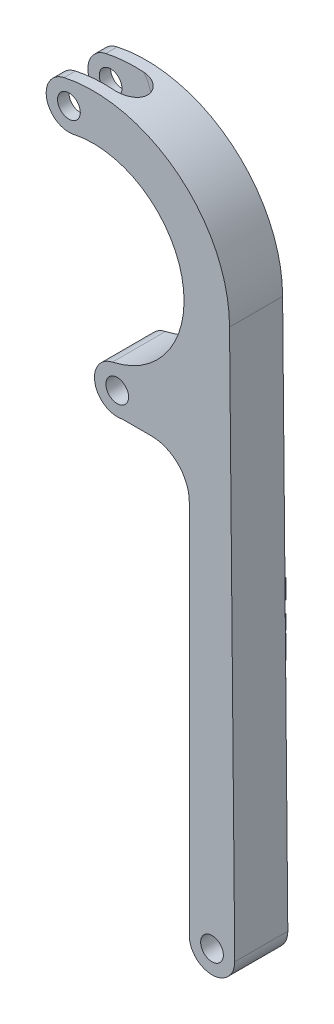
from build123d import *

# Parameters (mm, degrees)
CROQUIS1_R                  = 6
CROQUIS1_R_2                = 3
SALIENTE_EXTRUIR1_DEPTH     = 14
CORTAR_EXTRUIR1_START       = -3
CROQUIS3_R                  = 15
CORTAR_EXTRUIR1_DEPTH       = 8
REDONDEO1_R                 = 4
SALIENTE_EXTRUIR2_OUTLINE_W = 2.164556962
SALIENTE_EXTRUIR2_OUTLINE_H = 3.727848101
SALIENTE_EXTRUIR2_DEPTH     = 1


# Read off the part's stored shape, not the designer's step: Saliente-Extruir2
with BuildPart() as part:
    # Croquis1 → Saliente-Extruir1 (new body)
    # profile 1 of 5: a face of its own
    with BuildSketch(Plane.XY):
        with BuildLine():
            ThreePointArc((-23.725422134, 109.136941816), (-3.343361872, 121.724461131), (4.62711067, 144.315290918))
            ThreePointArc((4.62711067, 144.315290918), (-8.782059543, 172.344818376), (-39.020356526, 179.493640019))
            ThreePointArc((-39.020356526, 179.493640019), (-33.980640362, 178.302169745), (-31.74577866, 173.630581835))
            ThreePointArc((-31.74577866, 173.630581835), (-33.07419075, 169.865443538), (-36.471200794, 167.767523652))
            ThreePointArc((-36.471200794, 167.767523652), (-7.920656596, 149.413602382), (-26.274577866, 120.863058184))
            ThreePointArc((-26.274577866, 120.863058184), (-21.234861702, 119.67158791), (-19, 115))
            ThreePointArc((-19, 115), (-20.32841209, 111.234861702), (-23.725422134, 109.136941816))
        make_face()
    # profile 2 of 5: a face of its own
    with BuildSketch(Plane.XY):
        with Locations((-37.74577866, 173.630581835)):
            Circle(CROQUIS1_R)
        with Locations((-37.74577866, 173.630581835)):
            Circle(CROQUIS1_R_2, mode=Mode.SUBTRACT)
    # profile 3 of 5: a face of its own
    with BuildSketch(Plane.XY):
        with Locations((-25, 115)):
            Circle(CROQUIS1_R)
        with Locations((-25, 115)):
            Circle(CROQUIS1_R_2, mode=Mode.SUBTRACT)
    # profile 4 of 5: a face of its own
    with BuildSketch(Plane.XY):
        with BuildLine():
            Line((5.998914104, 0.114147164), (4.62711067, 144.315290918))
            ThreePointArc((4.62711067, 144.315290918), (-3.343361872, 121.724461131), (-23.725422134, 109.136941816))
            Line((-23.725422134, 109.136941816), (-16, 109.136941816))
            ThreePointArc((-16, 109.136941816), (-8.928932188, 106.208009628), (-6, 99.136941816))
            Line((-6, 99.136941816), (-6, 0))
            ThreePointArc((-6, 0), (-0.057076164, 5.99972852), (5.998914104, 0.114147164))
        make_face()
    # profile 5 of 5: a face of its own
    with BuildSketch(Plane.XY):
        with BuildLine():
            Line((6, 0), (5.998914104, 0.114147164))
            ThreePointArc((5.998914104, 0.114147164), (-0.057076164, 5.99972852), (-6, 0))
            ThreePointArc((-6, 0), (0, -6), (6, 0))
        make_face()
        Circle(CROQUIS1_R_2, mode=Mode.SUBTRACT)
    extrude(amount=SALIENTE_EXTRUIR1_DEPTH)

    # Croquis3 → Cortar-Extruir1 (cut)
    with BuildSketch(Plane.XY.offset(14).offset(CORTAR_EXTRUIR1_START)):
        with Locations((-37.74577866, 173.630581835)):
            Circle(CROQUIS3_R)
    extrude(amount=-CORTAR_EXTRUIR1_DEPTH, mode=Mode.SUBTRACT)

    # Redondeo1
    redondeo1_edges = [part.edges().sort_by_distance(p)[0] for p in [
        (-22.748314626, 173.3547693, 11),
        (-22.748314626, 173.3547693, 3),
    ]]
    fillet(redondeo1_edges, radius=REDONDEO1_R - 0.0001)  # a hair under: the kernel refuses the full size

    # Saliente-Extruir2 outline → Saliente-Extruir2 (add)
    # profile 1 of 5: a face of its own
    with BuildSketch(Plane(origin=(0, 0, 0), x_dir=(-1, 0, 0), z_dir=(0, 0, -1))):
        with BuildLine():
            add(Edge.make_bspline(
                [(1.227056962, 45.382004268), (1.173159704, 45.369650546), (1.070700251, 45.346165946), (0.925715434, 45.310156466), (0.799895763, 45.268441386), (0.691113524, 45.226076926), (0.60177617, 45.179003969), (0.52787352, 45.133055417), (0.473706833, 45.08166438), (0.425672622, 45.010214269), (0.391970564, 44.912875635), (0.353697368, 44.795216564), (0.332649693, 44.667344204), (0.32075523, 44.538593351), (0.314885121, 44.420040011), (0.315663804, 44.324068642), (0.309504425, 44.256562467), (0.309959197, 44.220814461), (0.310126582, 44.207656957)],
                knots=[0, 0, 0, 0, 0.096369473, 0.183199736, 0.260168196, 0.327254605, 0.3863241, 0.435970048, 0.47842448, 0.515356776, 0.584876185, 0.656696535, 0.730987281, 0.809942154, 0.882052186, 0.9377268, 0.977079565, 1, 1, 1, 1], degree=3))
            add(Edge.make_bspline(
                [(5.120253165, 48.145948097), (5.118708681, 48.058168777), (5.115687299, 47.886451362), (5.084472475, 47.635717516), (5.035984154, 47.398073021), (4.969199014, 47.173408624), (4.87956714, 46.962747327), (4.770972882, 46.765431517), (4.642013421, 46.581846155), (4.495347874, 46.413097551), (4.333230987, 46.258885691), (4.158945594, 46.120037812), (3.972737567, 45.997542333), (3.777243482, 45.887225293), (3.568107684, 45.795297104), (3.347351057, 45.721614399), (3.117109939, 45.657300404), (2.800609835, 45.602716602), (2.416872586, 45.55068649), (1.98460854, 45.484255597), (1.592315981, 45.430630737), (1.344187055, 45.397597648), (1.227056962, 45.382004268)],
                knots=[0, 0, 0, 0, 0.048830607, 0.095524386, 0.140369232, 0.183705339, 0.225721861, 0.26753402, 0.3088257, 0.350338942, 0.391758422, 0.433185235, 0.474175684, 0.515683073, 0.557976288, 0.601076244, 0.645129756, 0.690866583, 0.77964743, 0.860689261, 0.934237897, 1, 1, 1, 1], degree=3))
            add(Edge.make_bspline(
                [(2.234177215, 50.941834173), (2.34816094, 50.940388368), (2.561806769, 50.937678419), (2.86115806, 50.927487878), (3.116063253, 50.899803747), (3.337305252, 50.868609769), (3.539354567, 50.810513999), (3.739152001, 50.72554723), (3.943053922, 50.60588426), (4.152315372, 50.459384519), (4.358323192, 50.279003973), (4.542098846, 50.055376232), (4.708876089, 49.797099796), (4.852352516, 49.50474813), (4.972298269, 49.18803868), (5.059216596, 48.853089587), (5.11073964, 48.503935603), (5.117052847, 48.266373887), (5.120253165, 48.145948097)],
                knots=[0, 0, 0, 0, 0.074185321, 0.139049541, 0.194770103, 0.24100215, 0.284220415, 0.331153137, 0.381906579, 0.437765584, 0.497232502, 0.559433925, 0.625453012, 0.696901012, 0.770932802, 0.845466592, 0.92166327, 1, 1, 1, 1], degree=3))
            Line((2.234177215, 50.941834173), (2.234177215, 50.34056835))
            add(Edge.make_bspline(
                [(3.556962025, 49.906529584), (3.552597669, 49.945128712), (3.543920552, 50.021870649), (3.470889776, 50.124395241), (3.35331539, 50.197602254), (3.19761032, 50.251694462), (3.005845779, 50.290216197), (2.779194992, 50.319635603), (2.518206544, 50.338335605), (2.332543151, 50.339795099), (2.234177215, 50.34056835)],
                knots=[0, 0, 0, 0, 0.076379624, 0.151856288, 0.240834607, 0.348656789, 0.478908566, 0.630026959, 0.803985354, 1, 1, 1, 1], degree=3))
            add(Edge.make_bspline(
                [(0.29876583, 46.818984467), (0.305010012, 46.845440727), (0.34950794, 47.0325525), (0.416573676, 47.297639054), (0.514956713, 47.607976841), (0.606020567, 47.82981103), (0.713594595, 48.041645814), (0.834995702, 48.247000987), (0.981155861, 48.440962338), (1.155190055, 48.621934121), (1.358292774, 48.789640667), (1.586797318, 48.943125956), (1.832800975, 49.085385316), (2.092469224, 49.209012446), (2.358341477, 49.324570845), (2.627429543, 49.416386083), (2.876837949, 49.497545349), (3.086119187, 49.574677601), (3.248583592, 49.641062616), (3.367685907, 49.699915448), (3.452690074, 49.75430272), (3.507993909, 49.806695632), (3.548968439, 49.854739459), (3.55446263, 49.890336104), (3.556962025, 49.906529584)],
                knots=[0.081915594, 0.081915594, 0.081915594, 0.081915594, 0.097538274, 0.192448475, 0.239008343, 0.284532479, 0.330092183, 0.375468061, 0.421473558, 0.469338538, 0.51943898, 0.572556267, 0.627386583, 0.682608998, 0.737770368, 0.793900495, 0.845923327, 0.888519618, 0.922080751, 0.946712341, 0.964883242, 0.979655531, 0.990744977, 1, 1, 1, 1], degree=3))
            add(Edge.make_bspline(
                [(-2.108089399, 49.378543033), (-2.034709827, 49.376836932), (-1.886714385, 49.373395984), (-1.664114164, 49.341794784), (-1.439752252, 49.290890588), (-1.215845481, 49.219747719), (-0.996178509, 49.129993255), (-0.789679205, 49.011759465), (-0.596920915, 48.869789401), (-0.418152323, 48.704340335), (-0.256203892, 48.514829842), (-0.109785093, 48.303759864), (0.012730883, 48.066389421), (0.122186464, 47.806045473), (0.210116591, 47.512482809), (0.266851139, 47.179312711), (0.291312525, 46.9435085), (0.29876583, 46.818984467)],
                knots=[0, 0, 0, 0, 0.050680846, 0.102215562, 0.155024707, 0.209499325, 0.264395211, 0.318664872, 0.3734566, 0.429498824, 0.486579154, 0.545399895, 0.60657439, 0.670791493, 0.740348486, 0.817765563, 0.903985057, 0.903985057, 0.903985057, 0.903985057], degree=3))
            add(Edge.make_bspline(
                [(-4.511273734, 45.006213128), (-4.50955198, 45.197874208), (-4.506265139, 45.563756483), (-4.489306502, 46.087122363), (-4.454387377, 46.558202681), (-4.412866419, 46.981683256), (-4.346223538, 47.362569926), (-4.250785232, 47.706510805), (-4.128074335, 48.017158373), (-3.973539436, 48.291875577), (-3.797983089, 48.53567549), (-3.604438035, 48.749855269), (-3.395184801, 48.93706426), (-3.169745427, 49.095919475), (-2.926736648, 49.222450495), (-2.667805384, 49.314402844), (-2.392697869, 49.367209362), (-2.204138201, 49.37471818), (-2.108089399, 49.378543033)],
                knots=[0, 0, 0, 0, 0.102271433, 0.195236845, 0.279334408, 0.354289543, 0.422202057, 0.485367847, 0.544447062, 0.599953094, 0.65309905, 0.70444401, 0.753678076, 0.802630048, 0.851208711, 0.89940654, 0.948759555, 1, 1, 1, 1], degree=3))
            Line((-4.511273734, 45.006213128), (-4.5, 39.202118983))
            Line((-4.5, 39.202118983), (-4.026503165, 39.202118983))
            add(Edge.make_bspline(
                [(-3.29934731, 40.694009806), (-3.354570666, 40.687429536), (-3.455793411, 40.675368101), (-3.594785691, 40.645539064), (-3.704452405, 40.598708327), (-3.791925773, 40.541061855), (-3.853058942, 40.464427682), (-3.904170593, 40.37581224), (-3.93760305, 40.267890795), (-3.967479803, 40.109542612), (-3.988013174, 39.915338289), (-4.001189625, 39.688885825), (-4.008928354, 39.454357996), (-4.020265015, 39.291650799), (-4.026503165, 39.202118983)],
                knots=[0, 0, 0, 0, 0.087697202, 0.160746326, 0.223110375, 0.274881745, 0.323935795, 0.376110499, 0.435437977, 0.500891392, 0.630107775, 0.742885759, 0.858519443, 1, 1, 1, 1], degree=3))
            Line((-3.29934731, 40.694009806), (-2.724386867, 40.720315185))
            Line((-2.724386867, 40.720315185), (3.241297468, 40.720315185))
            Line((3.241297468, 40.720315185), (3.814378956, 40.694009806))
            add(Edge.make_bspline(
                [(4.518987342, 39.688768508), (4.507538536, 39.775185648), (4.485385726, 39.942398065), (4.460700286, 40.147081496), (4.43642724, 40.297533553), (4.404232927, 40.394410814), (4.359020701, 40.475991406), (4.300050123, 40.546569833), (4.218228783, 40.603024253), (4.109125318, 40.64534776), (3.971521721, 40.67538151), (3.869634415, 40.687459615), (3.814378956, 40.694009806)],
                knots=[0, 0, 0, 0, 0.185069921, 0.358100129, 0.437911598, 0.508140796, 0.573626925, 0.634928682, 0.701711692, 0.782218098, 0.881892656, 1, 1, 1, 1], degree=3))
            Line((4.518987342, 39.688768508), (4.518987342, 39.177692559))
            Line((4.518987342, 39.177692559), (5, 39.177692559))
            Line((5, 39.177692559), (5, 45.772827052))
            Line((5, 45.772827052), (4.537776899, 45.772827052))
            Line((4.537776899, 45.772827052), (4.473892405, 44.880323097))
            add(Edge.make_bspline(
                [(3.761768196, 44.232083381), (3.82277716, 44.239373602), (3.935273973, 44.252816326), (4.086836127, 44.292155155), (4.207665228, 44.34065284), (4.300604554, 44.405828464), (4.364882829, 44.494051534), (4.415520272, 44.600999153), (4.452037737, 44.732676684), (4.466260526, 44.828763422), (4.473892405, 44.880323097)],
                knots=[0, 0, 0, 0, 0.17001206, 0.313491885, 0.432393444, 0.529196786, 0.623224729, 0.731071164, 0.855694099, 1, 1, 1, 1], degree=3))
            Line((3.761768196, 44.232083381), (3.17929193, 44.205778002))
            Line((3.17929193, 44.205778002), (0.310126582, 44.207656957))
        make_face()
        with BuildLine():
            add(Edge.make_bspline(
                [(-0.170886076, 44.410584173), (-0.17099814, 44.466967138), (-0.171211178, 44.574153473), (-0.179477643, 44.727002716), (-0.189595814, 44.863126554), (-0.201198224, 44.948006441), (-0.206586234, 44.987423571)],
                knots=[0, 0, 0, 0, 0.292362208, 0.555792576, 0.79371577, 1, 1, 1, 1], degree=3))
            Line((-0.170886076, 44.410584173), (-0.170886076, 44.207656957))
            Line((-0.170886076, 44.207656957), (-4.018987342, 44.207656957))
            add(Edge.make_bspline(
                [(-2.119363133, 45.891201261), (-2.215359457, 45.888296319), (-2.407155602, 45.882492382), (-2.693322531, 45.835714803), (-2.975802212, 45.75817693), (-3.204872419, 45.669513036), (-3.378875534, 45.588013513), (-3.496333748, 45.524525772), (-3.598608672, 45.457069042), (-3.685455356, 45.385119577), (-3.759142923, 45.311633421), (-3.821154693, 45.237052234), (-3.865048598, 45.156189197), (-3.919950274, 44.996788942), (-3.964052212, 44.763099694), (-3.995379634, 44.518766799), (-3.996931059, 44.350914042), (-4.008496697, 44.272809251), (-4.003579853, 44.221729518), (-4.016995393, 44.20947632), (-4.018987342, 44.207656957)],
                knots=[0, 0, 0, 0, 0.098172887, 0.196144815, 0.295787264, 0.397412639, 0.447001532, 0.492311345, 0.533897757, 0.572130218, 0.607471872, 0.640295697, 0.670979507, 0.700979941, 0.812462339, 0.913015421, 0.954070211, 0.981690621, 0.997281411, 1, 1, 1, 1], degree=3))
            add(Edge.make_bspline(
                [(-0.206586234, 44.987423571), (-0.213558173, 45.022830284), (-0.227331196, 45.092776033), (-0.26857857, 45.191938342), (-0.323382879, 45.285612231), (-0.396152161, 45.371957304), (-0.48356563, 45.453657293), (-0.587229706, 45.528437674), (-0.706844662, 45.595811378), (-0.886394387, 45.67843342), (-1.131517017, 45.763843042), (-1.443484989, 45.839414847), (-1.775563427, 45.882540298), (-2.002744755, 45.888263424), (-2.119363133, 45.891201261)],
                knots=[0, 0, 0, 0, 0.047515565, 0.093866712, 0.140927226, 0.190241786, 0.242285916, 0.298494938, 0.358467051, 0.423178392, 0.559114176, 0.700242484, 0.846126284, 1, 1, 1, 1], degree=3))
        make_face(mode=Mode.SUBTRACT)
    # profile 2 of 5: a face of its own
    with BuildSketch(Plane(origin=(0, 0, 0), x_dir=(-1, 0, 0), z_dir=(0, 0, -1))):
        with BuildLine():
            add(Edge.make_bspline(
                [(4.101859177, 56.112720249), (4.054836962, 56.11084629), (3.950427368, 56.106685294), (3.779160525, 56.084390179), (3.577962195, 56.048403247), (3.434694925, 56.015672811), (3.357792722, 55.998103951)],
                knots=[0, 0, 0, 0, 0.187124924, 0.415498013, 0.686254291, 1, 1, 1, 1], degree=3))
            add(Edge.make_bspline(
                [(4.518987342, 54.821877685), (4.51893865, 54.863214833), (4.518849383, 54.938999605), (4.519400519, 55.042974054), (4.517855775, 55.127573678), (4.513617661, 55.200240567), (4.507143281, 55.274765784), (4.498400993, 55.365851816), (4.479632587, 55.480073497), (4.461555626, 55.610720316), (4.439229897, 55.740813031), (4.412392936, 55.853361498), (4.388595358, 55.942755223), (4.357635044, 56.009519998), (4.317646266, 56.060481443), (4.259175725, 56.092423754), (4.185663099, 56.110735264), (4.131426531, 56.112019914), (4.101859177, 56.112720249)],
                knots=[0, 0, 0, 0, 0.083055718, 0.152268816, 0.208911695, 0.253028245, 0.298488395, 0.359219382, 0.436814011, 0.53096031, 0.624270263, 0.70180364, 0.763517561, 0.809669159, 0.848983456, 0.891285838, 0.940733897, 1, 1, 1, 1], degree=3))
            Line((4.518987342, 54.821877685), (5, 54.821877685))
            Line((5, 54.821877685), (5, 61.16335316))
            Line((5, 61.16335316), (4.54153481, 61.16335316))
            Line((4.54153481, 61.16335316), (4.470134494, 60.430560438))
            add(Edge.make_bspline(
                [(3.763647152, 59.744741609), (3.826097874, 59.773922747), (3.941422316, 59.82781001), (4.093020575, 59.913910389), (4.212514348, 59.992531928), (4.30215521, 60.069113117), (4.364676821, 60.151406348), (4.414310841, 60.236177999), (4.451144151, 60.329953778), (4.463697221, 60.396457182), (4.470134494, 60.430560438)],
                knots=[0, 0, 0, 0, 0.199997517, 0.369324825, 0.505452432, 0.614897504, 0.709439734, 0.803912036, 0.899445174, 1, 1, 1, 1], degree=3))
            Line((3.763647152, 59.744741609), (2.784711234, 59.352039869))
            Line((2.784711234, 59.352039869), (-4.5, 56.642585755))
            Line((-4.5, 56.642585755), (-4.5, 54.966557274))
            Line((-4.5, 54.966557274), (2.788469146, 52.510762179))
            add(Edge.make_bspline(
                [(4.470134494, 51.116577052), (4.46133835, 51.180688279), (4.444814317, 51.301124689), (4.403148646, 51.467880714), (4.352791305, 51.609868841), (4.286305433, 51.726882654), (4.209778651, 51.823930921), (4.12389176, 51.907897739), (4.027810281, 51.980472058), (3.917991518, 52.037330405), (3.798203038, 52.091951146), (3.668524259, 52.152216935), (3.52384165, 52.214067898), (3.32142372, 52.301050857), (3.076236241, 52.404773718), (2.880174534, 52.476985861), (2.788469146, 52.510762179)],
                knots=[0, 0, 0, 0, 0.08243783, 0.154863929, 0.21878486, 0.273849001, 0.325600662, 0.375852317, 0.426634015, 0.478441081, 0.533092664, 0.594547417, 0.660703262, 0.733673069, 0.87542894, 1, 1, 1, 1], degree=3))
            Line((4.470134494, 51.116577052), (4.52838212, 50.220315185))
            Line((4.52838212, 50.220315185), (5, 50.220315185))
            Line((5, 50.220315185), (5, 54.299528002))
            Line((5, 54.299528002), (4.535897943, 54.299528002))
            add(Edge.make_bspline(
                [(4.002274525, 52.865884806), (4.042438763, 52.866643355), (4.115797946, 52.868028831), (4.214170202, 52.885109205), (4.290161757, 52.916399748), (4.361267273, 52.980392363), (4.415097881, 53.096743397), (4.453463382, 53.261158103), (4.482510295, 53.450075156), (4.494593065, 53.623012766), (4.50506372, 53.779619311), (4.511224122, 53.927580932), (4.523598096, 54.104103842), (4.531600849, 54.231254306), (4.535897943, 54.299528002)],
                knots=[0, 0, 0, 0, 0.069839927, 0.12756124, 0.172939357, 0.21077845, 0.291250571, 0.390397372, 0.505096531, 0.623230203, 0.692041756, 0.778266174, 0.880939578, 1, 1, 1, 1], degree=3))
            add(Edge.make_bspline(
                [(3.32772943, 52.98613797), (3.392681018, 52.967853924), (3.515589185, 52.933254945), (3.693098494, 52.895489483), (3.853152965, 52.870976518), (3.954600636, 52.867512617), (4.002274525, 52.865884806)],
                knots=[0, 0, 0, 0, 0.294468034, 0.557223116, 0.791923306, 1, 1, 1, 1], degree=3))
            Line((3.32772943, 52.98613797), (2.113924051, 53.367565976))
            Line((2.113924051, 53.367565976), (2.113924051, 55.552791451))
            Line((2.113924051, 55.552791451), (3.357792722, 55.998103951))
        make_face()
        Polygon((-1.249406646, 54.434812812), (1.632911392, 55.41374873), (1.632911392, 53.497213919), align=None, mode=Mode.SUBTRACT)
    # profile 3 of 5: a face of its own
    with BuildSketch(Plane(origin=(0, 0, 0), x_dir=(-1, 0, 0), z_dir=(0, 0, -1))):
        with BuildLine():
            add(Edge.make_bspline(
                [(-3.4609375, 68.739302527), (-3.499925425, 68.73811256), (-3.573014434, 68.735881779), (-3.672733053, 68.713412234), (-3.756668488, 68.678902318), (-3.838032484, 68.604452289), (-3.909290628, 68.482469618), (-3.96005582, 68.314509722), (-3.987450556, 68.132596302), (-4.002153855, 67.939086987), (-4.008268973, 67.722527532), (-4.021251839, 67.568663385), (-4.02838212, 67.484160122)],
                knots=[0, 0, 0, 0, 0.074885306, 0.140384307, 0.195946889, 0.247197868, 0.349536703, 0.463508134, 0.583193599, 0.702909406, 0.836835774, 1, 1, 1, 1], degree=3))
            add(Edge.make_bspline(
                [(1.525810918, 67.243653793), (1.355233128, 67.291128017), (0.998549028, 67.390398274), (0.444849215, 67.561196199), (-0.152192816, 67.752484183), (-0.669528182, 67.926109625), (-1.085610075, 68.070102554), (-1.380171004, 68.169131376), (-1.650601988, 68.259749989), (-1.897236232, 68.339674531), (-2.118103934, 68.414328199), (-2.316677335, 68.475546796), (-2.490468508, 68.530476792), (-2.684334143, 68.588497859), (-2.893324613, 68.647915979), (-3.11460721, 68.698598925), (-3.299576967, 68.732385008), (-3.41135555, 68.737176951), (-3.4609375, 68.739302527)],
                knots=[0, 0, 0, 0, 0.101881696, 0.213038175, 0.333397406, 0.462638664, 0.527033775, 0.586754064, 0.641459273, 0.691150361, 0.735940396, 0.775607567, 0.810716736, 0.840818413, 0.892057671, 0.935684206, 0.971471257, 1, 1, 1, 1], degree=3))
            add(Edge.make_bspline(
                [(-3.584948576, 65.612720249), (-3.540389038, 65.615676628), (-3.439279305, 65.622384929), (-3.271366938, 65.654532503), (-3.07095602, 65.709242023), (-2.88114109, 65.76596569), (-2.709463137, 65.825366326), (-2.558710841, 65.87543955), (-2.39290834, 65.933582709), (-2.211542297, 65.998216359), (-2.013825799, 66.067167586), (-1.800624178, 66.144622986), (-1.570875784, 66.226507801), (-1.325098933, 66.318793495), (-1.057539142, 66.414320257), (-0.765345437, 66.51669904), (-0.446412293, 66.622185223), (-0.102832374, 66.738277528), (0.267794548, 66.855891179), (0.66409156, 66.97903543), (1.085304082, 67.11233075), (1.375988797, 67.198989113), (1.525810918, 67.243653793)],
                knots=[0, 0, 0, 0, 0.024926154, 0.056559759, 0.095251492, 0.140955651, 0.167173914, 0.196710887, 0.229679986, 0.265307289, 0.304252802, 0.346633718, 0.39200329, 0.440481608, 0.493263568, 0.550682955, 0.613407197, 0.680888199, 0.753242097, 0.83058206, 0.912680118, 1, 1, 1, 1], degree=3))
            add(Edge.make_bspline(
                [(-3.968255538, 66.016695723), (-3.954894163, 65.958298408), (-3.931716624, 65.856998504), (-3.913336863, 65.732895149), (-3.860799752, 65.661600767), (-3.791906353, 65.631487823), (-3.698029352, 65.614445562), (-3.625793099, 65.613343428), (-3.584948576, 65.612720249)],
                knots=[0, 0, 0, 0, 0.276069672, 0.47888899, 0.562786921, 0.669422307, 0.813081553, 1, 1, 1, 1], degree=3))
            Line((-3.968255538, 66.016695723), (-4.039655854, 66.779551736))
            Line((-4.039655854, 66.779551736), (-4.5, 66.779551736))
            Line((-4.5, 66.779551736), (-4.5, 60.562087337))
            Line((-4.5, 60.562087337), (-4.030261076, 60.562087337))
            Line((-4.030261076, 60.562087337), (-3.968255538, 61.18965854))
            add(Edge.make_bspline(
                [(-3.259889241, 61.971304109), (-3.317742722, 61.942350559), (-3.42602399, 61.888159749), (-3.573480506, 61.805584024), (-3.690613702, 61.721731644), (-3.786605175, 61.64223684), (-3.857944526, 61.550616288), (-3.91062809, 61.445209416), (-3.948008149, 61.323132454), (-3.961284008, 61.235615941), (-3.968255538, 61.18965854)],
                knots=[0, 0, 0, 0, 0.173777363, 0.325249795, 0.453133104, 0.560418454, 0.658673408, 0.762487291, 0.875275344, 1, 1, 1, 1], degree=3))
            Line((-3.259889241, 61.971304109), (-2.282832278, 62.36400585))
            Line((-2.282832278, 62.36400585), (5, 64.985149046))
            Line((5, 64.985149046), (5, 66.578503476))
            Line((5, 66.578503476), (-2.311016614, 69.17897816))
            Line((-2.311016614, 69.17897816), (-3.280557753, 69.560406166))
            add(Edge.make_bspline(
                [(-4.043413766, 71.264618983), (-4.037742964, 71.212638763), (-4.027293714, 71.116857905), (-4.013437283, 70.985441567), (-4.005666682, 70.878885827), (-4.002741002, 70.790420337), (-3.996099226, 70.705864618), (-3.987292283, 70.610492769), (-3.970614934, 70.49676769), (-3.954756423, 70.368854106), (-3.928075672, 70.23693848), (-3.888595491, 70.113014227), (-3.840076066, 70.000830459), (-3.778436053, 69.89841672), (-3.693997313, 69.805186261), (-3.581890829, 69.718944899), (-3.442536658, 69.634649394), (-3.336874378, 69.58621896), (-3.280557753, 69.560406166)],
                knots=[0, 0, 0, 0, 0.077961471, 0.143654965, 0.197013663, 0.237211376, 0.275600393, 0.323453594, 0.379978698, 0.446934379, 0.515613089, 0.580289884, 0.640497807, 0.697514443, 0.757693392, 0.82682138, 0.907698041, 1, 1, 1, 1], degree=3))
            Line((-4.043413766, 71.264618983), (-4.5, 71.264618983))
            Line((-4.5, 71.264618983), (-4.5, 67.484160122))
            Line((-4.5, 67.484160122), (-4.02838212, 67.484160122))
        make_face()
    # profile 4 of 5: a face of its own
    with BuildSketch(Plane(origin=(0, 0, 0), x_dir=(-1, 0, 0), z_dir=(0, 0, -1))):
        with BuildLine():
            add(Edge.make_bspline(
                [(-3.248615506, 76.048440185), (-3.303269067, 76.041313154), (-3.404636255, 76.028094489), (-3.543792716, 75.995014862), (-3.658442644, 75.950709504), (-3.751470948, 75.893634863), (-3.822478265, 75.818050397), (-3.875373286, 75.72444407), (-3.91480876, 75.612532797), (-3.943329167, 75.436660188), (-3.96786467, 75.203369612), (-3.989414685, 74.921811427), (-4.005582813, 74.650232949), (-4.022268768, 74.475091317), (-4.030261076, 74.391201261)],
                knots=[0, 0, 0, 0, 0.079277431, 0.147037634, 0.205276841, 0.255527941, 0.302702786, 0.352783886, 0.409224145, 0.472503008, 0.608552787, 0.746864297, 0.878752025, 1, 1, 1, 1], degree=3))
            Line((-3.248615506, 76.048440185), (-2.673655063, 76.074745565))
            Line((-2.673655063, 76.074745565), (3.241297468, 76.074745565))
            Line((3.241297468, 76.074745565), (3.8125, 76.048440185))
            add(Edge.make_bspline(
                [(4.518987342, 74.547154584), (4.51951399, 74.624192813), (4.520434764, 74.758883761), (4.515706248, 74.921810386), (4.50740422, 75.043898789), (4.497837166, 75.152253077), (4.484645728, 75.284469479), (4.467662996, 75.432083226), (4.443444181, 75.579329357), (4.411239297, 75.710014562), (4.360931706, 75.812413986), (4.300873228, 75.894363915), (4.215994925, 75.954120635), (4.106584235, 75.997219634), (3.969369736, 76.030725151), (3.867820966, 76.042192882), (3.8125, 76.048440185)],
                knots=[0, 0, 0, 0, 0.121494847, 0.212417343, 0.256965344, 0.314468083, 0.383956349, 0.46653357, 0.548702153, 0.619394521, 0.677706011, 0.727693064, 0.777874924, 0.83896469, 0.91227241, 1, 1, 1, 1], degree=3))
            Line((4.518987342, 74.547154584), (5, 74.547154584))
            Line((5, 74.547154584), (5, 80.950635597))
            Line((5, 80.950635597), (4.535897943, 80.950635597))
            add(Edge.make_bspline(
                [(3.836926424, 79.58275585), (3.898469566, 79.589209521), (4.00903479, 79.600803854), (4.155911075, 79.630291357), (4.267438141, 79.665737851), (4.344870948, 79.718264198), (4.393244232, 79.781726455), (4.431720092, 79.850529808), (4.459973469, 79.929873837), (4.479694509, 80.046842348), (4.493297066, 80.191239175), (4.501691685, 80.338027375), (4.505687557, 80.46781113), (4.514463638, 80.597993106), (4.522862739, 80.762808199), (4.531291409, 80.884258934), (4.535897943, 80.950635597)],
                knots=[0, 0, 0, 0, 0.103283324, 0.185553475, 0.250081709, 0.297388022, 0.339048479, 0.382129439, 0.428783541, 0.478843465, 0.579812263, 0.670972982, 0.724364997, 0.796666956, 0.888872069, 1, 1, 1, 1], degree=3))
            Line((3.836926424, 79.58275585), (3.25820807, 79.560208381))
            Line((3.25820807, 79.560208381), (-4.5, 79.562087337))
            Line((-4.5, 79.562087337), (-4.5, 74.391201261))
            Line((-4.5, 74.391201261), (-4.030261076, 74.391201261))
        make_face()
    # profile 5 of 5: a face of its own
    with BuildSketch(Plane(origin=(0, 0, 0), x_dir=(-1, 0, 0), z_dir=(0, 0, -1))):
        with Locations((1.753164557, 72.527277211)):
            Rectangle(SALIENTE_EXTRUIR2_OUTLINE_W, SALIENTE_EXTRUIR2_OUTLINE_H)
    extrude(amount=SALIENTE_EXTRUIR2_DEPTH)


solid = part.part
